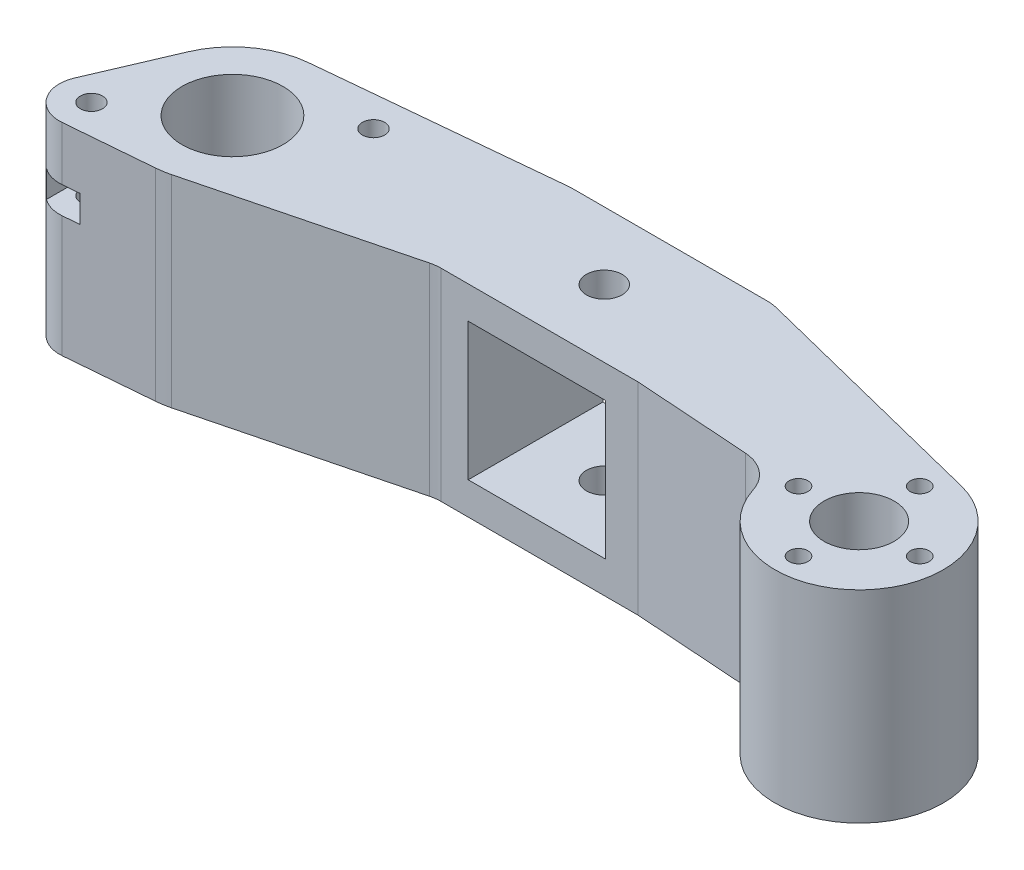
from build123d import *

# Parameters (mm, degrees)
SKETCH1_W           = 30
SKETCH1_H           = 30
SKETCH1_W_2         = 20.4
SKETCH1_H_2         = 20.4
BOSS_EXTRUDE1_DEPTH = 20
SKETCH2_R           = 2.65
CUT_EXTRUDE1_DEPTH  = 40.05124838
SKETCH3_R           = 1.65
SKETCH3_R_2         = 7.5
SKETCH3_R_3         = 1.4
SKETCH3_R_4         = 5.2
BOSS_EXTRUDE2_DEPTH = 30
CUT_EXTRUDE5_START  = -8
CUT_EXTRUDE5_DEPTH  = 4
FILLET1_R           = 6


with BuildPart() as part:
    # Sketch1 → Boss-Extrude1 (new body)
    with BuildSketch(Plane.XY):
        Rectangle(SKETCH1_W, SKETCH1_H)
        Rectangle(SKETCH1_W_2, SKETCH1_H_2, mode=Mode.SUBTRACT)
    extrude(amount=BOSS_EXTRUDE1_DEPTH)

    # Sketch2 → Cut-Extrude1 (cut, through all)
    with BuildSketch(Plane(origin=(0, 15, 0), x_dir=(1, 0, 0), z_dir=(0, 1, 0))):
        with Locations(Location((0, -10, 0), (0, 0, 180))):
            Circle(SKETCH2_R)
    extrude(amount=-CUT_EXTRUDE1_DEPTH, mode=Mode.SUBTRACT)

    # Sketch3 → Boss-Extrude2 (add)
    # profile 1 of 2: a face of its own
    with BuildSketch(Plane(origin=(0, 15, 0), x_dir=(1, 0, 0), z_dir=(0, 1, 0))):
        with BuildLine():
            ThreePointArc((-65.896564393, -22.761029428), (-65.378707028, -27.432622684), (-61.107872478, -29.395256638))
            Line((-61.107872478, -29.395256638), (-48.296614461, -28.315868679))
            ThreePointArc((-48.296614461, -28.315868679), (-47.269565487, -28.186320273), (-46.256757774, -27.972234028))
            Line((-46.256757774, -27.972234028), (-15, -20))
            Line((-15, -20), (-15, 0))
            Line((-15, 0), (-50.542410203, -3.417381881))
            ThreePointArc((-50.542410203, -3.417381881), (-56.721658538, -5.767897005), (-60.8377203, -10.941490233))
            Line((-60.8377203, -10.941490233), (-65.896564393, -22.761029428))
        make_face()
        with Locations(Location((-61.508592346, -24.639111653, 0), (0, 0, 180))):
            Circle(SKETCH3_R, mode=Mode.SUBTRACT)
        with Locations(Location((-49.346059773, -15.86, 0), (0, 0, 180))):
            Circle(SKETCH3_R_2, mode=Mode.SUBTRACT)
        with Locations(Location((-37.1835272, -7.080888347, 0), (0, 0, 180))):
            Circle(SKETCH3_R, mode=Mode.SUBTRACT)
    # profile 2 of 2: a face of its own
    with BuildSketch(Plane(origin=(0, 15, 0), x_dir=(1, 0, 0), z_dir=(0, 1, 0))):
        with BuildLine():
            Line((52.386539741, -9.375418293), (15, 0))
            Line((15, 0), (15, -20))
            Line((15, -20), (36.846059773, -21.5))
            ThreePointArc((36.846059773, -21.5), (57.035142957, -31.355353865), (52.386539741, -9.375418293))
        make_face()
        with Locations(Location((49.346059773, -12.5, 0), (0, 0, 180))):
            Circle(SKETCH3_R_3, mode=Mode.SUBTRACT)
        with Locations(Location((49.346059773, -30.5, 0), (0, 0, 180))):
            Circle(SKETCH3_R_3, mode=Mode.SUBTRACT)
        with Locations(Location((40.346059773, -21.5, 0), (0, 0, 180))):
            Circle(SKETCH3_R_3, mode=Mode.SUBTRACT)
        with Locations(Location((49.346059773, -21.5, 0), (0, 0, 180))):
            Circle(SKETCH3_R_4, mode=Mode.SUBTRACT)
        with Locations(Location((58.346059773, -21.5, 0), (0, 0, 180))):
            Circle(SKETCH3_R_3, mode=Mode.SUBTRACT)
    extrude(amount=-BOSS_EXTRUDE2_DEPTH)

    # Sketch5 → Cut-Extrude5 (cut)
    with BuildSketch(Plane(origin=(0, 15, 0), x_dir=(1, 0, 0), z_dir=(0, 1, 0)).offset(CUT_EXTRUDE5_START)):
        Polygon((-40.041411033, -8.730888347), (-37.1835272, -10.380888347), (-34.325643368, -8.730888347), align=None)
        Polygon((-40.041411033, -8.730888347), (-34.325643368, -8.730888347), (-34.325643368, -5.430888347), (-37.1835272, -3.780888347), (-40.041411033, -5.430888347), align=None)
        Polygon((-37.1835272, -3.780888347), (-34.325643368, -5.430888347), (-34.325643368, 4.153358906), (-40.041411033, 4.153358906), (-40.041411033, -5.430888347), align=None)
        Polygon((-64.366476179, -26.289111653), (-61.508592346, -27.939111653), (-58.650708514, -26.289111653), (-58.650708514, -22.989111653), (-64.366476179, -22.989111653), align=None)
        Polygon((-58.650708514, -26.289111653), (-61.508592346, -27.939111653), (-64.366476179, -26.289111653), (-64.366476179, -31.820729818), (-58.650708514, -31.820729818), align=None)
        Polygon((-64.366476179, -22.989111653), (-58.650708514, -22.989111653), (-61.508592346, -21.339111653), align=None)
    extrude(amount=-CUT_EXTRUDE5_DEPTH, mode=Mode.SUBTRACT)

    # Fillet1
    # the kernel refuses this fillet: 6 mm, written as the material it adds along each edge
    with BuildSketch(Plane(origin=(36.846059773, 15, 21.5), x_dir=(0.15492828046990675, 0, 0.9879257198345622), z_dir=(0, -1, 0))) as fillet1_piece_1:
        with BuildLine():
            CenterArc((4.802776695, 5.927554319), FILLET1_R, 192.840529968, 68.246833251)
            Line((-1.047177652, 4.594124851), (0, 0))
            ThreePointArc((0, 0), (1.936603506, 0.150928502), (3.873207012, 0))
        make_face()
    extrude(amount=30)
    with BuildSketch(Plane(origin=(-15, -15, 20), x_dir=(1, 0, 0), z_dir=(0, 1, 0))) as fillet1_piece_2:
        with BuildLine():
            CenterArc((FILLET1_R * 0.125518959216, -FILLET1_R), FILLET1_R, 90, 14.308582401)
            Line((-FILLET1_R * 0.121625200721, -FILLET1_R * 0.0310212777315), (0, 0))
            Line((0, 0), (FILLET1_R * 0.125518959216, 0))
        make_face()
    extrude(amount=30)
    # the kernel refuses this fillet: 6 mm, written as the material it takes off along each edge
    with BuildSketch(Plane(origin=(15, 16.852100476, 0), x_dir=(-1, 0, 0), z_dir=(0, -1, 0))) as fillet1_2_piece_1:
        with BuildLine():
            CenterArc((FILLET1_R * 0.123473365094, -FILLET1_R), FILLET1_R, 90, 14.07775236)
            Line((-FILLET1_R * 0.119765032297, -FILLET1_R * 0.0300334634457), (0, 0))
            Line((0, 0), (FILLET1_R * 0.123473365094, 0))
        make_face()
    extrude(amount=33.704200953, mode=Mode.SUBTRACT)
    with BuildSketch(Plane(origin=(-15, -15.71946162, 0), x_dir=(1, 0, 0), z_dir=(0, 1, 0))) as fillet1_2_piece_2:
        with BuildLine():
            CenterArc((FILLET1_R * 0.0479641080127, -FILLET1_R), FILLET1_R, 90, 5.492072889)
            Line((-FILLET1_R * 0.0477439263528, -FILLET1_R * 0.004590550498), (0, 0))
            Line((0, 0), (FILLET1_R * 0.0479641080127, 0))
        make_face()
    extrude(amount=31.43892324, mode=Mode.SUBTRACT)


solid = part.part
